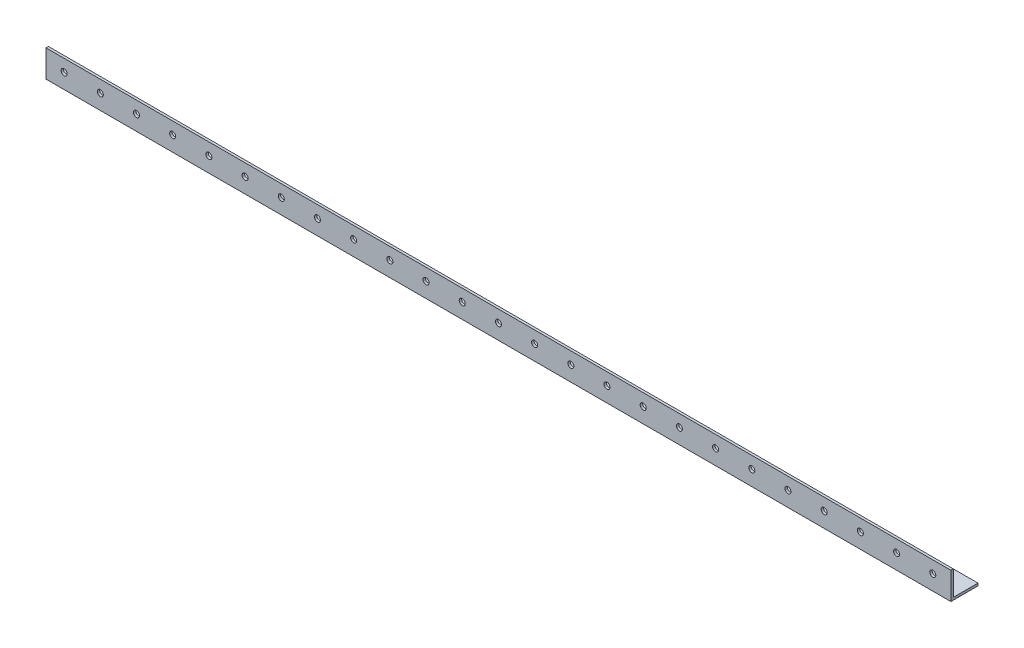
from build123d import *

# Parameters (mm, degrees)
EXTRUDE_1_DEPTH     = 1500
SKETCH_2_R          = 5
CUT_EXTRUDE_1_DEPTH = 1502.349393046


with BuildPart() as part:
    # Эскиз1 → Вытянуть-Тонкостенный1 (new body)
    with BuildSketch(Plane(origin=(0, 0, 0), x_dir=(0, 0, -1), z_dir=(1, 0, 0))):
        Polygon((45, 0), (0, 0), (0, 45), (4, 45), (4, 4), (45, 4), align=None)
    extrude(amount=EXTRUDE_1_DEPTH)

    # Эскиз2 → Вырез-Вытянуть1 (cut, through all)
    with BuildSketch(Plane.XY):
        with Locations((30, 25)):
            Circle(SKETCH_2_R)
        with Locations((90, 25)):
            Circle(SKETCH_2_R)
        with Locations((150, 25)):
            Circle(SKETCH_2_R)
        with Locations((210, 25)):
            Circle(SKETCH_2_R)
        with Locations((270, 25)):
            Circle(SKETCH_2_R)
        with Locations((330, 25)):
            Circle(SKETCH_2_R)
        with Locations((390, 25)):
            Circle(SKETCH_2_R)
        with Locations((450, 25)):
            Circle(SKETCH_2_R)
        with Locations((510, 25)):
            Circle(SKETCH_2_R)
        with Locations((570, 25)):
            Circle(SKETCH_2_R)
        with Locations((630, 25)):
            Circle(SKETCH_2_R)
        with Locations((690, 25)):
            Circle(SKETCH_2_R)
        with Locations((750, 25)):
            Circle(SKETCH_2_R)
        with Locations((810, 25)):
            Circle(SKETCH_2_R)
        with Locations((870, 25)):
            Circle(SKETCH_2_R)
        with Locations((930, 25)):
            Circle(SKETCH_2_R)
        with Locations((990, 25)):
            Circle(SKETCH_2_R)
        with Locations((1050, 25)):
            Circle(SKETCH_2_R)
        with Locations((1110, 25)):
            Circle(SKETCH_2_R)
        with Locations((1170, 25)):
            Circle(SKETCH_2_R)
        with Locations((1230, 25)):
            Circle(SKETCH_2_R)
        with Locations((1290, 25)):
            Circle(SKETCH_2_R)
        with Locations((1350, 25)):
            Circle(SKETCH_2_R)
        with Locations((1410, 25)):
            Circle(SKETCH_2_R)
        with Locations((1470, 25)):
            Circle(SKETCH_2_R)
    extrude(amount=-CUT_EXTRUDE_1_DEPTH, mode=Mode.SUBTRACT)


solid = part.part
